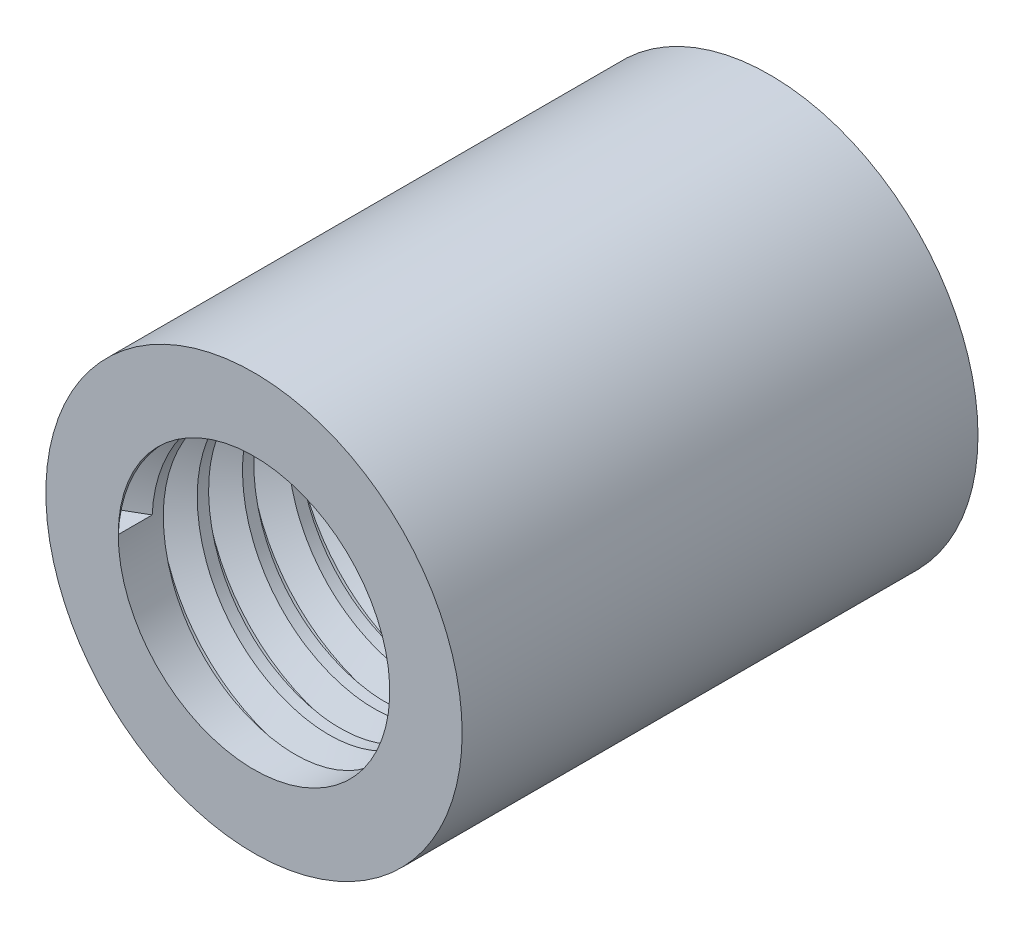
from build123d import *

# Parameters (mm, degrees)
SKETCH1_R           = 2.3
SKETCH1_R_2         = 1.5
BOSS_EXTRUDE1_DEPTH = 5.7
THREAD1_PITCH       = 0.5


with BuildPart() as part:
    # Sketch1 → Boss-Extrude1 (new body)
    with BuildSketch(Plane.XY):
        Circle(SKETCH1_R)
        Circle(SKETCH1_R_2, mode=Mode.SUBTRACT)
    extrude(amount=BOSS_EXTRUDE1_DEPTH)

    # Thread1: the profile of Thread Profile1 profile screwed along a right-hand helix of 20 turns, 6 arcs to a turn; built about Z, then put on its axis
    thread1_z = Axis((0, 0, 0), (0, 0, 1))
    thread1_corners = [(1.4997, 0, -0.000173205), (1.770632938, 0, 0.156249999), (1.770632938, 0, 0.218749999), (1.4997, 0, 0.375173204)]
    with BuildLine(mode=Mode.PRIVATE) as thread1_profile:
        Line(thread1_corners[0], thread1_corners[1])
        Line(thread1_corners[1], thread1_corners[2])
        Line(thread1_corners[2], thread1_corners[3])
        Line(thread1_corners[3], thread1_corners[0])
    thread1_cap = Face(thread1_profile.wire())
    thread1_turn_angles = [0, 30, 60, 90, 120, 150, 180, 210, 240, 270, 300, 330, 360]
    thread1_turn_weights = [1, 0.8660254037844387, 1, 0.8660254037844387, 1, 0.8660254037844387, 1, 0.8660254037844387, 1, 0.8660254037844387, 1, 0.8660254037844387, 1]
    thread1_turn_rails = [Edge.make_bspline([Vector(p[0], p[1], 0).rotate(thread1_z, thread1_turn_angles[k]) / thread1_turn_weights[k] + Vector(0, 0, p[2] + THREAD1_PITCH * thread1_turn_angles[k] / 360) for k in range(13)], [0, 0, 0, 1, 1, 2, 2, 3, 3, 4, 4, 5, 5, 6, 6, 6], 2, thread1_turn_weights) for p in thread1_corners]
    thread1_turn_sides = [Face.make_surface_from_curves(thread1_turn_rails[p[0]], thread1_turn_rails[p[1]]) for p in [(0, 1), (1, 2), (2, 3), (3, 0)]]
    thread1 = Plane(origin=(0, 0, 5.7), x_dir=(-1, 0, 0), z_dir=(0, 0, -1)) * Solid(Shell([*[p.moved(Location((0, 0, THREAD1_PITCH * i))) for i in range(20) for p in thread1_turn_sides], thread1_cap, thread1_cap.rotate(thread1_z, 7200).moved(Location((0, 0, THREAD1_PITCH * 7200 / 360)))]))
    add(thread1, mode=Mode.SUBTRACT)


solid = part.part
